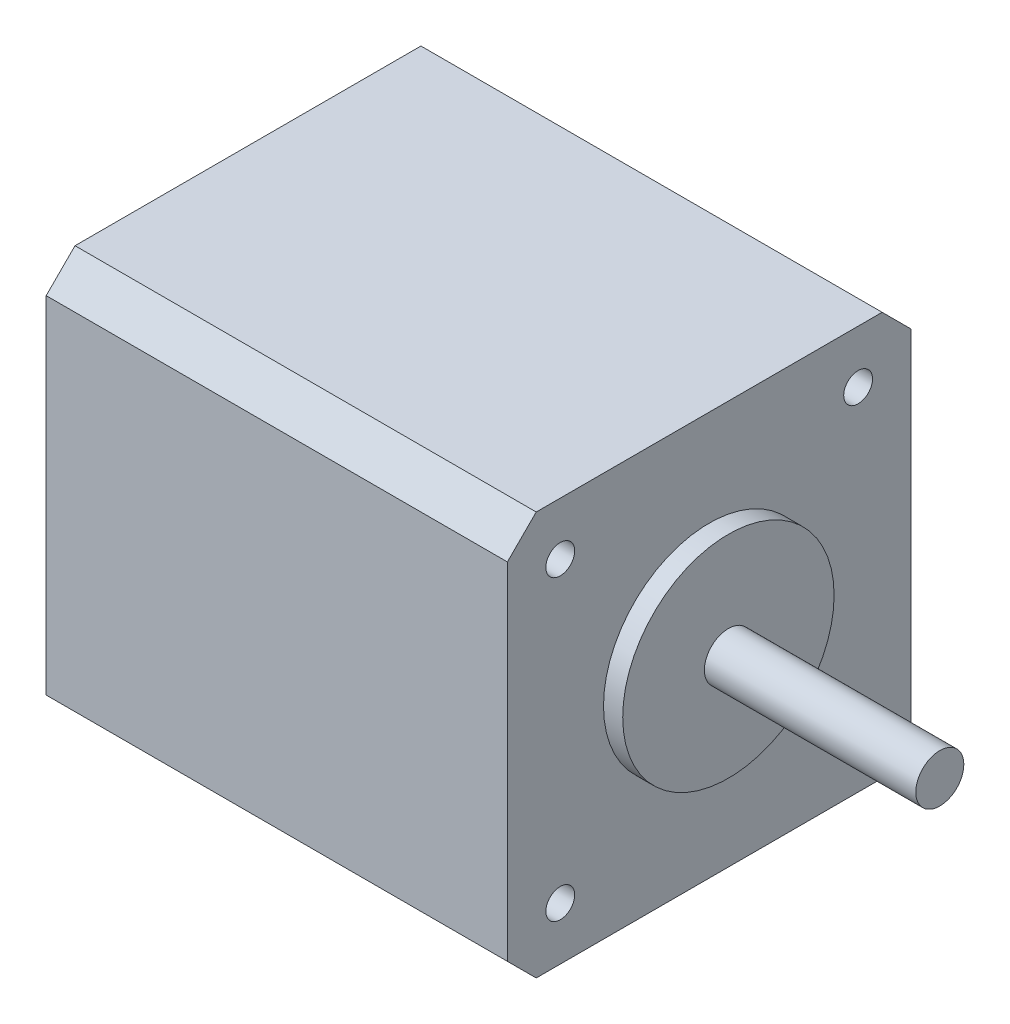
from build123d import *

# Parameters (mm, degrees)
STOCK_AXIS_MASTER_1_START       = 135
STOCK_AXIS_MASTER_1_OUTLINE_R   = 1.5
STOCK_AXIS_MASTER_1_DEPTH       = 48
STOCK_AXIS_MASTER_1_START_2     = 185.5
STOCK_AXIS_MASTER_1_2_OUTLINE_R = 7.25
STOCK_AXIS_MASTER_1_2_DEPTH     = 19
STOCK_AXIS_MASTER_1_START_3     = 183
STOCK_AXIS_MASTER_1_3_OUTLINE_R = 11
STOCK_AXIS_MASTER_1_3_DEPTH     = 2
STOCK_AXIS_MASTER_1_START_4     = 185
STOCK_AXIS_MASTER_1_4_OUTLINE_R = 2.5
STOCK_AXIS_MASTER_1_4_DEPTH     = 22
CUT_EXTRUDE1_START              = -22
SKETCH1_R                       = 7.25
SKETCH1_R_2                     = 2.5
CUT_EXTRUDE1_DEPTH              = 22


# Read off the part's stored shape, not the designer's step: Stock-axis-master-1
with BuildPart() as part:
    # Stock-axis-master-1 outline → Stock-axis-master-1 (new body)
    with BuildSketch(Plane.YZ.offset(STOCK_AXIS_MASTER_1_START)):
        Polygon((49, -21), (52, -18), (52, 18), (49, 21), (13, 21), (10, 18), (10, -18), (13, -21), align=None)
        with Locations((15.5, -15.5)):
            Circle(STOCK_AXIS_MASTER_1_OUTLINE_R, mode=Mode.SUBTRACT)
        with Locations((46.5, -15.5)):
            Circle(STOCK_AXIS_MASTER_1_OUTLINE_R, mode=Mode.SUBTRACT)
        with Locations((15.5, 15.5)):
            Circle(STOCK_AXIS_MASTER_1_OUTLINE_R, mode=Mode.SUBTRACT)
        with Locations((46.5, 15.5)):
            Circle(STOCK_AXIS_MASTER_1_OUTLINE_R, mode=Mode.SUBTRACT)
    extrude(amount=STOCK_AXIS_MASTER_1_DEPTH)

    # Stock-axis-master-1 3 outline → Stock-axis-master-1 3 (add)
    with BuildSketch(Plane.YZ.offset(STOCK_AXIS_MASTER_1_START_3)):
        with Locations((31, 0)):
            Circle(STOCK_AXIS_MASTER_1_3_OUTLINE_R)
    extrude(amount=STOCK_AXIS_MASTER_1_3_DEPTH)



with BuildPart() as body_2:
    # Stock-axis-master-1 2 outline → Stock-axis-master-1 2 (new body)
    with BuildSketch(Plane.YZ.offset(STOCK_AXIS_MASTER_1_START_2)):
        with Locations((31, 0)):
            Circle(STOCK_AXIS_MASTER_1_2_OUTLINE_R)
    extrude(amount=STOCK_AXIS_MASTER_1_2_DEPTH)


with BuildPart() as part_1:
    add(part.part)

    add(body_2.part)  # Stock-axis-master-1 4 merges body 2
    # Stock-axis-master-1 4 outline → Stock-axis-master-1 4 (add)
    with BuildSketch(Plane.YZ.offset(STOCK_AXIS_MASTER_1_START_4)):
        with Locations((31, 0)):
            Circle(STOCK_AXIS_MASTER_1_4_OUTLINE_R)
    extrude(amount=STOCK_AXIS_MASTER_1_4_DEPTH)

    # Sketch1 → Cut-Extrude1 (cut)
    with BuildSketch(Plane(origin=(207, 0, 0), x_dir=(0, 0, -1), z_dir=(1, 0, 0)).offset(CUT_EXTRUDE1_START)):
        with Locations((0, 31)):
            Circle(SKETCH1_R)
        with Locations((0, 31)):
            Circle(SKETCH1_R_2, mode=Mode.SUBTRACT)
    extrude(amount=CUT_EXTRUDE1_DEPTH, mode=Mode.SUBTRACT)


solid = part_1.part
